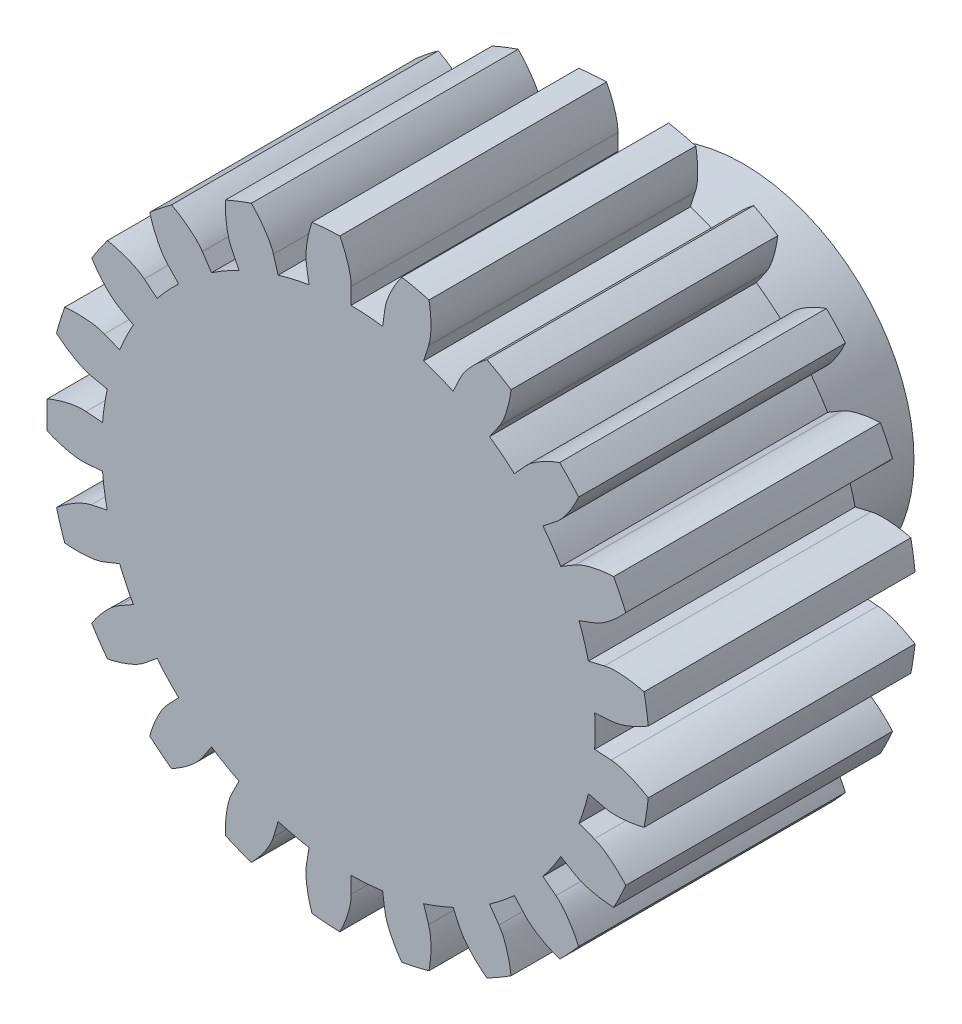
from build123d import *

# Parameters (mm, degrees)
SKETCH_1_R               = 5.75
SKETCH_1_R_2             = 1.475
EXTRUDE_1_DEPTH          = 5
CUT_EXTRUDE_1_DEPTH      = 10.545941546
PATTERN_CIRCULAR_1_DEPTH = 5
SKETCH_2_R               = 1.475
EXTRUDE_2_DEPTH          = 5
SKETCH_3_R               = 3.2
SKETCH_3_R_2             = 2.2
EXTRUDE_3_DEPTH          = 2.4
SKETCH_5_R               = 1.2
CUT_EXTRUDE_2_DEPTH      = 1
SKETCH_6_OUTSIDE_W       = 17.032
SKETCH_6_OUTSIDE_H       = 17.06
SKETCH_6_OUTSIDE_R       = 5.65
CUT_EXTRUDE_3_DEPTH      = 11.992693278


# Read off the part's stored shape, not the designer's step: 阵列(圆周)1
with BuildPart() as part:
    # 草图1 → 凸台-拉伸1 (new body)
    with BuildSketch(Plane.XY):
        Circle(SKETCH_1_R)
        Circle(SKETCH_1_R_2, mode=Mode.SUBTRACT)
    extrude(amount=EXTRUDE_1_DEPTH)

    # 草图1<3> → 切除-拉伸1 (cut, through all)
    with BuildSketch(Plane.XY):
        with BuildLine():
            Line((4.923195788, 0.316927775), (4.615446536, 0.297116602))
            ThreePointArc((4.615446536, 0.297116602), (4.622611017, 0.148635076), (4.625, 0))
            ThreePointArc((4.625, 0), (4.622611017, -0.148635076), (4.615446536, -0.297116602))
            Line((4.615446536, -0.297116602), (4.923195788, -0.316927775))
            add(Edge.make_bspline(
                [(4.923195788, -0.316927775), (4.960723978, -0.31934363), (5.064950694, -0.333885203), (5.258056408, -0.392528318), (5.454545861, -0.4832362), (5.608701438, -0.573335861), (5.701232058, -0.634072387), (5.713983029, -0.642571358)],
                knots=[0, 0, 0, 0, 0, 0.005604068, 0.015718248, 0.029959916, 0.032248441, 0.032248441, 0.032248441, 0.032248441, 0.032248441], degree=4))
            ThreePointArc((5.713983029, -0.642571358), (5.740988696, -0.321789983), (5.75, 0))
            ThreePointArc((5.75, 0), (5.740988696, 0.321789983), (5.713983029, 0.642571358))
            add(Edge.make_bspline(
                [(4.923195788, 0.316927775), (4.960723978, 0.31934363), (5.064950694, 0.333885203), (5.258056408, 0.392528318), (5.454545861, 0.4832362), (5.608701438, 0.573335861), (5.701232058, 0.634072387), (5.713983029, 0.642571358)],
                knots=[0, 0, 0, 0, 0, 0.005604068, 0.015718248, 0.029959916, 0.032248441, 0.032248441, 0.032248441, 0.032248441, 0.032248441], degree=4))
        make_face()
    extrude(amount=CUT_EXTRUDE_1_DEPTH, mode=Mode.SUBTRACT)

    # 阵列(圆周)1 outline → 阵列(圆周)1 (cut)
    with BuildSketch(Plane.XY):
        with BuildLine():
            Line((4.497971852, 1.076510204), (4.797888114, 1.14828987))
            add(Edge.make_bspline(
                [(4.797888114, 1.14828987), (4.834461118, 1.157042973), (4.938343537, 1.173868805), (5.140155468, 1.174749947), (5.354652063, 1.145988245), (5.528516281, 1.105329614), (5.634838431, 1.07456532), (5.649528027, 1.070202349)],
                knots=[0, 0, 0, 0, 0, 0.005604068, 0.015718248, 0.029959916, 0.032248441, 0.032248441, 0.032248441, 0.032248441, 0.032248441], degree=4))
            ThreePointArc((5.649528027, 1.070202349), (5.494543634, 1.694842253), (5.270725563, 2.298249779))
            add(Edge.make_bspline(
                [(4.611055911, 1.753984996), (4.646204743, 1.76735515), (4.741514754, 1.811972045), (4.908755962, 1.92492872), (5.069779322, 2.069522988), (5.190528858, 2.201057927), (5.261046198, 2.286369979), (5.270725563, 2.298249779)],
                knots=[0, 0, 0, 0, 0, 0.005604068, 0.015718248, 0.029959916, 0.032248441, 0.032248441, 0.032248441, 0.032248441, 0.032248441], degree=4))
            Line((4.611055911, 1.753984996), (4.32281854, 1.644343293))
            ThreePointArc((4.32281854, 1.644343293), (4.419524227, 1.363242682), (4.497971852, 1.076510204))
        make_face()
        with BuildLine():
            add(Edge.make_bspline(
                [(4.611055911, -1.753984996), (4.646204743, -1.76735515), (4.741514754, -1.811972045), (4.908755962, -1.92492872), (5.069779322, -2.069522988), (5.190528858, -2.201057927), (5.261046198, -2.286369979), (5.270725562, -2.298249779)],
                knots=[0, 0, 0, 0, 0, 0.005604068, 0.015718248, 0.029959916, 0.032248441, 0.032248441, 0.032248441, 0.032248441, 0.032248441], degree=4))
            ThreePointArc((5.270725562, -2.298249779), (5.494543634, -1.694842253), (5.649528028, -1.070202349))
            add(Edge.make_bspline(
                [(4.797888114, -1.14828987), (4.834461118, -1.157042973), (4.938343537, -1.173868805), (5.140155468, -1.174749947), (5.354652063, -1.145988245), (5.528516281, -1.105329614), (5.634838431, -1.07456532), (5.649528028, -1.070202349)],
                knots=[0, 0, 0, 0, 0, 0.005604068, 0.015718248, 0.029959916, 0.032248441, 0.032248441, 0.032248441, 0.032248441, 0.032248441], degree=4))
            Line((4.797888114, -1.14828987), (4.497971852, -1.076510204))
            ThreePointArc((4.497971852, -1.076510204), (4.419524227, -1.363242682), (4.32281854, -1.644343293))
            Line((4.32281854, -1.644343293), (4.611055911, -1.753984996))
        make_face()
        with BuildLine():
            add(Edge.make_bspline(
                [(3.889203481, -3.035192954), (3.918849827, -3.058329409), (3.996774421, -3.12905722), (4.123291007, -3.286290758), (4.234540642, -3.471923576), (4.311155011, -3.633206338), (4.353393294, -3.735513566), (4.359141, -3.749718622)],
                knots=[0, 0, 0, 0, 0, 0.005604068, 0.015718248, 0.029959916, 0.032248441, 0.032248441, 0.032248441, 0.032248441, 0.032248441], degree=4))
            ThreePointArc((4.359141, -3.749718622), (4.750872953, -3.239090334), (5.083087669, -2.687883881))
            add(Edge.make_bspline(
                [(4.246267026, -2.511476921), (4.278635171, -2.53062123), (4.372942885, -2.577319418), (4.565529157, -2.637646525), (4.77897393, -2.673386606), (4.957098192, -2.685781701), (5.067764682, -2.687723183), (5.083087669, -2.687883881)],
                knots=[0, 0, 0, 0, 0, 0.005604068, 0.015718248, 0.029959916, 0.032248441, 0.032248441, 0.032248441, 0.032248441, 0.032248441], degree=4))
            Line((4.246267026, -2.511476921), (3.98083263, -2.354484354))
            ThreePointArc((3.98083263, -2.354484354), (3.821354331, -2.605355269), (3.646089147, -2.845462867))
            Line((3.646089147, -2.845462867), (3.889203481, -3.035192954))
        make_face()
        with BuildLine():
            add(Edge.make_bspline(
                [(2.821778254, -4.046710697), (2.843287907, -4.077557678), (2.896903141, -4.168111928), (2.971453551, -4.35565144), (3.023044444, -4.565828519), (3.048716122, -4.742528422), (3.058922292, -4.852740379), (3.060227629, -4.86800851)],
                knots=[0, 0, 0, 0, 0, 0.005604068, 0.015718248, 0.029959916, 0.032248441, 0.032248441, 0.032248441, 0.032248441, 0.032248441], degree=4))
            ThreePointArc((3.060227629, -4.86800851), (3.585066361, -4.495531025), (4.064992664, -4.066735134))
            add(Edge.make_bspline(
                [(3.317346479, -3.651508226), (3.342633714, -3.679342685), (3.418987068, -3.75176389), (3.585235545, -3.866176633), (3.778662992, -3.963242834), (3.945220174, -4.027590298), (4.050397801, -4.062065045), (4.064992664, -4.066735134)],
                knots=[0, 0, 0, 0, 0, 0.005604068, 0.015718248, 0.029959916, 0.032248441, 0.032248441, 0.032248441, 0.032248441, 0.032248441], degree=4))
            Line((3.317346479, -3.651508226), (3.109978959, -3.423252236))
            ThreePointArc((3.109978959, -3.423252236), (2.883640334, -3.615970606), (2.645388733, -3.793750578))
            Line((2.645388733, -3.793750578), (2.821778254, -4.046710697))
        make_face()
        with BuildLine():
            add(Edge.make_bspline(
                [(1.503625646, -4.698660436), (1.515087378, -4.734477054), (1.539629304, -4.836811601), (1.555589407, -5.037993377), (1.54293748, -5.254039561), (1.515385427, -5.430456043), (1.492652621, -5.538779913), (1.489399604, -5.553754479)],
                knots=[0, 0, 0, 0, 0, 0.005604068, 0.015718248, 0.029959916, 0.032248441, 0.032248441, 0.032248441, 0.032248441, 0.032248441], degree=4))
            ThreePointArc((1.489399604, -5.553754479), (2.10071089, -5.352524055), (2.685705221, -5.084239124))
            add(Edge.make_bspline(
                [(2.093665138, -4.467087001), (2.109624581, -4.501138397), (2.161239245, -4.592847677), (2.286378021, -4.751179981), (2.442601265, -4.900947544), (2.58279203, -5.011529822), (2.6731353, -5.075474603), (2.685705221, -5.084239124)],
                knots=[0, 0, 0, 0, 0, 0.005604068, 0.015718248, 0.029959916, 0.032248441, 0.032248441, 0.032248441, 0.032248441, 0.032248441], degree=4))
            Line((2.093665138, -4.467087001), (1.96279001, -4.187849135))
            ThreePointArc((1.96279001, -4.187849135), (1.689702238, -4.305291087), (1.409633921, -4.404946902))
            Line((1.409633921, -4.404946902), (1.503625646, -4.698660436))
        make_face()
        with BuildLine():
            add(Edge.make_bspline(
                [(0.051869301, -4.933113576), (0.052264687, -4.970717367), (0.045552647, -5.075739337), (0.001504318, -5.272687494), (-0.074266251, -5.475406131), (-0.152593914, -5.635863813), (-0.206245786, -5.732674546), (-0.213768111, -5.746024991)],
                knots=[0, 0, 0, 0, 0, 0.005604068, 0.015718248, 0.029959916, 0.032248441, 0.032248441, 0.032248441, 0.032248441, 0.032248441], degree=4))
            ThreePointArc((-0.213768111, -5.746024991), (0.429698038, -5.733921834), (1.067781084, -5.649986156))
            add(Edge.make_bspline(
                [(0.683952463, -4.885745492), (0.689166047, -4.922988208), (0.711455832, -5.025836792), (0.784365777, -5.214020138), (0.889503696, -5.403181558), (0.990871481, -5.550172928), (1.058352997, -5.637905968), (1.067781084, -5.649986156)],
                knots=[0, 0, 0, 0, 0, 0.005604068, 0.015718248, 0.029959916, 0.032248441, 0.032248441, 0.032248441, 0.032248441, 0.032248441], degree=4))
            Line((0.683952463, -4.885745492), (0.641198555, -4.58033726))
            ThreePointArc((0.641198555, -4.58033726), (0.345626683, -4.612067562), (0.048626948, -4.624744363))
            Line((0.048626948, -4.624744363), (0.051869301, -4.933113576))
        make_face()
        with BuildLine():
            add(Edge.make_bspline(
                [(-1.404495859, -4.729237926), (-1.415201951, -4.765287628), (-1.452571563, -4.863665358), (-1.552714436, -5.038880188), (-1.684871098, -5.210258837), (-1.807014616, -5.340500352), (-1.886818351, -5.417195888), (-1.897941592, -5.427735966)],
                knots=[0, 0, 0, 0, 0, 0.005604068, 0.015718248, 0.029959916, 0.032248441, 0.032248441, 0.032248441, 0.032248441, 0.032248441], degree=4))
            ThreePointArc((-1.897941592, -5.427735966), (-1.27949537, -5.605835495), (-0.645020088, -5.713707123))
            add(Edge.make_bspline(
                [(-0.786532391, -4.870284055), (-0.792527914, -4.907408914), (-0.801543555, -5.012258252), (-0.787340809, -5.213571724), (-0.74263018, -5.425319178), (-0.689092349, -5.595658814), (-0.650468614, -5.699384647), (-0.645020088, -5.713707123)],
                knots=[0, 0, 0, 0, 0, 0.005604068, 0.015718248, 0.029959916, 0.032248441, 0.032248441, 0.032248441, 0.032248441, 0.032248441], degree=4))
            Line((-0.786532391, -4.870284055), (-0.737366206, -4.565842319))
            ThreePointArc((-0.737366206, -4.565842319), (-1.02915932, -4.509041594), (-1.316700742, -4.433612991))
            Line((-1.316700742, -4.433612991), (-1.404495859, -4.729237926))
        make_face()
        with BuildLine():
            add(Edge.make_bspline(
                [(-2.736065398, -4.105148733), (-2.756921685, -4.136441171), (-2.821628415, -4.219433368), (-2.968967699, -4.357346265), (-3.145767755, -4.482157182), (-3.300874139, -4.570609997), (-3.399738824, -4.620375602), (-3.413474634, -4.627168781)],
                knots=[0, 0, 0, 0, 0, 0.005604068, 0.015718248, 0.029959916, 0.032248441, 0.032248441, 0.032248441, 0.032248441, 0.032248441], degree=4))
            ThreePointArc((-3.413474634, -4.627168781), (-2.875, -4.979646072), (-2.300508395, -5.269740138))
            add(Edge.make_bspline(
                [(-2.18713039, -4.422076508), (-2.203802293, -4.455784801), (-2.243322279, -4.553318571), (-2.289088709, -4.749874583), (-2.308778105, -4.965393381), (-2.307827299, -5.143945858), (-2.301493234, -5.254447989), (-2.300508395, -5.269740138)],
                knots=[0, 0, 0, 0, 0, 0.005604068, 0.015718248, 0.029959916, 0.032248441, 0.032248441, 0.032248441, 0.032248441, 0.032248441], degree=4))
            Line((-2.18713039, -4.422076508), (-2.050412743, -4.145652251))
            ThreePointArc((-2.050412743, -4.145652251), (-2.3125, -4.005367493), (-2.565033793, -3.848535649))
            Line((-2.565033793, -3.848535649), (-2.736065398, -4.105148733))
        make_face()
        with BuildLine():
            add(Edge.make_bspline(
                [(-3.82452352, -3.116299059), (-3.853676829, -3.140053764), (-3.939971199, -3.200286207), (-4.121415153, -3.288643004), (-4.327149142, -3.355796191), (-4.501436509, -3.394600886), (-4.610577583, -3.413014668), (-4.625705474, -3.415457344)],
                knots=[0, 0, 0, 0, 0, 0.005604068, 0.015718248, 0.029959916, 0.032248441, 0.032248441, 0.032248441, 0.032248441, 0.032248441], degree=4))
            ThreePointArc((-4.625705474, -3.415457344), (-4.215048263, -3.910993242), (-3.751586435, -4.357533617))
            add(Edge.make_bspline(
                [(-3.393392255, -3.580948056), (-3.419259167, -3.608244655), (-3.485771974, -3.689796553), (-3.587441031, -3.864130241), (-3.669780964, -4.064270592), (-3.721501666, -4.235170738), (-3.748020081, -4.342630568), (-3.751586435, -4.357533617)],
                knots=[0, 0, 0, 0, 0, 0.005604068, 0.015718248, 0.029959916, 0.032248441, 0.032248441, 0.032248441, 0.032248441, 0.032248441], degree=4))
            Line((-3.393392255, -3.580948056), (-3.18127111, -3.357102787))
            ThreePointArc((-3.18127111, -3.357102787), (-3.390364907, -3.145798912), (-3.585452335, -2.921499025))
            Line((-3.585452335, -2.921499025), (-3.82452352, -3.116299059))
        make_face()
        with BuildLine():
            add(Edge.make_bspline(
                [(-4.573155944, -1.850552538), (-4.608015875, -1.8646588), (-4.708230253, -1.896779572), (-4.907656784, -1.92772938), (-5.124044338, -1.931257982), (-5.302026492, -1.91696659), (-5.411746291, -1.902392403), (-5.426922084, -1.900267533)],
                knots=[0, 0, 0, 0, 0, 0.005604068, 0.015718248, 0.029959916, 0.032248441, 0.032248441, 0.032248441, 0.032248441, 0.032248441], degree=4))
            ThreePointArc((-5.426922084, -1.900267533), (-5.18057099, -2.4948315), (-4.869319557, -3.05814111))
            add(Edge.make_bspline(
                [(-4.298136328, -2.421636656), (-4.330899858, -2.440096137), (-4.418495532, -2.498419919), (-4.567033475, -2.635040969), (-4.70470768, -2.802019525), (-4.804504278, -2.950082113), (-4.861518895, -3.044951364), (-4.869319557, -3.05814111)],
                knots=[0, 0, 0, 0, 0, 0.005604068, 0.015718248, 0.029959916, 0.032248441, 0.032248441, 0.032248441, 0.032248441, 0.032248441], degree=4))
            Line((-4.298136328, -2.421636656), (-4.029459578, -2.270260009))
            ThreePointArc((-4.029459578, -2.270260009), (-4.166981014, -2.006712294), (-4.287287702, -1.734874393))
            Line((-4.287287702, -1.734874393), (-4.573155944, -1.850552538))
        make_face()
        with BuildLine():
            add(Edge.make_bspline(
                [(-4.915443393, -0.420376303), (-4.952912488, -0.423580718), (-5.058142386, -0.424735748), (-5.257831572, -0.395528542), (-5.465645708, -0.335119025), (-5.631508153, -0.2690014), (-5.732057592, -0.222734224), (-5.74593285, -0.216230613)],
                knots=[0, 0, 0, 0, 0, 0.005604068, 0.015718248, 0.029959916, 0.032248441, 0.032248441, 0.032248441, 0.032248441, 0.032248441], degree=4))
            ThreePointArc((-5.74593285, -0.216230613), (-5.685777251, -0.856993031), (-5.554392268, -1.487019346))
            add(Edge.make_bspline(
                [(-4.820972125, -1.047152211), (-4.857721092, -1.055134369), (-4.958616372, -1.085047711), (-5.140824952, -1.171816744), (-5.321600472, -1.290796727), (-5.460605601, -1.402865745), (-5.543050421, -1.476714868), (-5.554392268, -1.487019346)],
                knots=[0, 0, 0, 0, 0, 0.005604068, 0.015718248, 0.029959916, 0.032248441, 0.032248441, 0.032248441, 0.032248441, 0.032248441], degree=4))
            Line((-4.820972125, -1.047152211), (-4.51961288, -0.981694666))
            ThreePointArc((-4.51961288, -0.981694666), (-4.573342571, -0.689320481), (-4.608178743, -0.394098556))
            Line((-4.608178743, -0.394098556), (-4.915443393, -0.420376303))
        make_face()
        with BuildLine():
            add(Edge.make_bspline(
                [(-4.820972125, 1.047152211), (-4.857721092, 1.055134369), (-4.958616372, 1.085047711), (-5.140824952, 1.171816744), (-5.321600472, 1.290796727), (-5.460605601, 1.402865745), (-5.543050421, 1.476714868), (-5.554392268, 1.487019346)],
                knots=[0, 0, 0, 0, 0, 0.005604068, 0.015718248, 0.029959916, 0.032248441, 0.032248441, 0.032248441, 0.032248441, 0.032248441], degree=4))
            ThreePointArc((-5.554392268, 1.487019346), (-5.685777251, 0.856993031), (-5.74593285, 0.216230613))
            add(Edge.make_bspline(
                [(-4.915443393, 0.420376303), (-4.952912488, 0.423580718), (-5.058142386, 0.424735748), (-5.257831572, 0.395528542), (-5.465645708, 0.335119025), (-5.631508153, 0.2690014), (-5.732057592, 0.222734224), (-5.74593285, 0.216230613)],
                knots=[0, 0, 0, 0, 0, 0.005604068, 0.015718248, 0.029959916, 0.032248441, 0.032248441, 0.032248441, 0.032248441, 0.032248441], degree=4))
            Line((-4.915443393, 0.420376303), (-4.608178743, 0.394098556))
            ThreePointArc((-4.608178743, 0.394098556), (-4.573342571, 0.689320481), (-4.51961288, 0.981694666))
            Line((-4.51961288, 0.981694666), (-4.820972125, 1.047152211))
        make_face()
        with BuildLine():
            add(Edge.make_bspline(
                [(-4.298136328, 2.421636656), (-4.330899858, 2.440096137), (-4.418495532, 2.498419919), (-4.567033475, 2.635040969), (-4.70470768, 2.802019525), (-4.804504278, 2.950082113), (-4.861518895, 3.044951364), (-4.869319557, 3.05814111)],
                knots=[0, 0, 0, 0, 0, 0.005604068, 0.015718248, 0.029959916, 0.032248441, 0.032248441, 0.032248441, 0.032248441, 0.032248441], degree=4))
            ThreePointArc((-4.869319557, 3.05814111), (-5.18057099, 2.4948315), (-5.426922084, 1.900267533))
            add(Edge.make_bspline(
                [(-4.573155944, 1.850552538), (-4.608015875, 1.8646588), (-4.708230253, 1.896779572), (-4.907656784, 1.92772938), (-5.124044338, 1.931257982), (-5.302026492, 1.91696659), (-5.411746291, 1.902392403), (-5.426922084, 1.900267533)],
                knots=[0, 0, 0, 0, 0, 0.005604068, 0.015718248, 0.029959916, 0.032248441, 0.032248441, 0.032248441, 0.032248441, 0.032248441], degree=4))
            Line((-4.573155944, 1.850552538), (-4.287287702, 1.734874393))
            ThreePointArc((-4.287287702, 1.734874393), (-4.166981014, 2.006712294), (-4.029459578, 2.270260009))
            Line((-4.029459578, 2.270260009), (-4.298136328, 2.421636656))
        make_face()
        with BuildLine():
            add(Edge.make_bspline(
                [(-3.393392255, 3.580948056), (-3.419259167, 3.608244655), (-3.485771974, 3.689796553), (-3.587441031, 3.864130241), (-3.669780964, 4.064270592), (-3.721501666, 4.235170738), (-3.748020081, 4.342630568), (-3.751586435, 4.357533617)],
                knots=[0, 0, 0, 0, 0, 0.005604068, 0.015718248, 0.029959916, 0.032248441, 0.032248441, 0.032248441, 0.032248441, 0.032248441], degree=4))
            ThreePointArc((-3.751586435, 4.357533617), (-4.215048263, 3.910993242), (-4.625705474, 3.415457344))
            add(Edge.make_bspline(
                [(-3.82452352, 3.116299059), (-3.853676829, 3.140053764), (-3.939971199, 3.200286207), (-4.121415153, 3.288643004), (-4.327149142, 3.355796191), (-4.501436509, 3.394600886), (-4.610577583, 3.413014668), (-4.625705474, 3.415457344)],
                knots=[0, 0, 0, 0, 0, 0.005604068, 0.015718248, 0.029959916, 0.032248441, 0.032248441, 0.032248441, 0.032248441, 0.032248441], degree=4))
            Line((-3.82452352, 3.116299059), (-3.585452335, 2.921499025))
            ThreePointArc((-3.585452335, 2.921499025), (-3.390364907, 3.145798912), (-3.18127111, 3.357102787))
            Line((-3.18127111, 3.357102787), (-3.393392255, 3.580948056))
        make_face()
        with BuildLine():
            add(Edge.make_bspline(
                [(-2.18713039, 4.422076508), (-2.203802293, 4.455784801), (-2.243322279, 4.553318571), (-2.289088709, 4.749874583), (-2.308778105, 4.965393381), (-2.307827299, 5.143945858), (-2.301493234, 5.254447989), (-2.300508395, 5.269740138)],
                knots=[0, 0, 0, 0, 0, 0.005604068, 0.015718248, 0.029959916, 0.032248441, 0.032248441, 0.032248441, 0.032248441, 0.032248441], degree=4))
            ThreePointArc((-2.300508395, 5.269740138), (-2.875, 4.979646072), (-3.413474634, 4.627168781))
            add(Edge.make_bspline(
                [(-2.736065398, 4.105148733), (-2.756921685, 4.136441171), (-2.821628415, 4.219433368), (-2.968967699, 4.357346265), (-3.145767755, 4.482157182), (-3.300874139, 4.570609997), (-3.399738824, 4.620375602), (-3.413474634, 4.627168781)],
                knots=[0, 0, 0, 0, 0, 0.005604068, 0.015718248, 0.029959916, 0.032248441, 0.032248441, 0.032248441, 0.032248441, 0.032248441], degree=4))
            Line((-2.736065398, 4.105148733), (-2.565033793, 3.848535649))
            ThreePointArc((-2.565033793, 3.848535649), (-2.3125, 4.005367493), (-2.050412743, 4.145652251))
            Line((-2.050412743, 4.145652251), (-2.18713039, 4.422076508))
        make_face()
        with BuildLine():
            add(Edge.make_bspline(
                [(-0.786532391, 4.870284055), (-0.792527914, 4.907408914), (-0.801543555, 5.012258252), (-0.787340809, 5.213571724), (-0.74263018, 5.425319178), (-0.689092349, 5.595658814), (-0.650468614, 5.699384647), (-0.645020088, 5.713707123)],
                knots=[0, 0, 0, 0, 0, 0.005604068, 0.015718248, 0.029959916, 0.032248441, 0.032248441, 0.032248441, 0.032248441, 0.032248441], degree=4))
            ThreePointArc((-0.645020088, 5.713707123), (-1.27949537, 5.605835495), (-1.897941592, 5.427735966))
            add(Edge.make_bspline(
                [(-1.404495859, 4.729237926), (-1.415201951, 4.765287628), (-1.452571563, 4.863665358), (-1.552714436, 5.038880188), (-1.684871098, 5.210258837), (-1.807014616, 5.340500352), (-1.886818351, 5.417195888), (-1.897941592, 5.427735966)],
                knots=[0, 0, 0, 0, 0, 0.005604068, 0.015718248, 0.029959916, 0.032248441, 0.032248441, 0.032248441, 0.032248441, 0.032248441], degree=4))
            Line((-1.404495859, 4.729237926), (-1.316700742, 4.433612991))
            ThreePointArc((-1.316700742, 4.433612991), (-1.02915932, 4.509041594), (-0.737366206, 4.565842319))
            Line((-0.737366206, 4.565842319), (-0.786532391, 4.870284055))
        make_face()
        with BuildLine():
            add(Edge.make_bspline(
                [(0.683952463, 4.885745492), (0.689166047, 4.922988208), (0.711455832, 5.025836792), (0.784365777, 5.214020138), (0.889503696, 5.403181558), (0.990871481, 5.550172928), (1.058352997, 5.637905968), (1.067781084, 5.649986155)],
                knots=[0, 0, 0, 0, 0, 0.005604068, 0.015718248, 0.029959916, 0.032248441, 0.032248441, 0.032248441, 0.032248441, 0.032248441], degree=4))
            ThreePointArc((1.067781084, 5.649986155), (0.429698038, 5.733921834), (-0.213768111, 5.746024991))
            add(Edge.make_bspline(
                [(0.051869301, 4.933113576), (0.052264687, 4.970717367), (0.045552647, 5.075739337), (0.001504318, 5.272687494), (-0.074266251, 5.475406131), (-0.152593914, 5.635863813), (-0.206245786, 5.732674546), (-0.213768111, 5.746024991)],
                knots=[0, 0, 0, 0, 0, 0.005604068, 0.015718248, 0.029959916, 0.032248441, 0.032248441, 0.032248441, 0.032248441, 0.032248441], degree=4))
            Line((0.051869301, 4.933113576), (0.048626948, 4.624744363))
            ThreePointArc((0.048626948, 4.624744363), (0.345626683, 4.612067562), (0.641198555, 4.58033726))
            Line((0.641198555, 4.58033726), (0.683952463, 4.885745492))
        make_face()
        with BuildLine():
            add(Edge.make_bspline(
                [(2.093665138, 4.467087001), (2.109624581, 4.501138397), (2.161239245, 4.592847677), (2.286378021, 4.751179981), (2.442601265, 4.900947544), (2.58279203, 5.011529822), (2.6731353, 5.075474603), (2.685705221, 5.084239123)],
                knots=[0, 0, 0, 0, 0, 0.005604068, 0.015718248, 0.029959916, 0.032248441, 0.032248441, 0.032248441, 0.032248441, 0.032248441], degree=4))
            ThreePointArc((2.685705221, 5.084239123), (2.10071089, 5.352524055), (1.489399605, 5.55375448))
            add(Edge.make_bspline(
                [(1.503625646, 4.698660436), (1.515087378, 4.734477054), (1.539629304, 4.836811601), (1.555589407, 5.037993377), (1.54293748, 5.254039561), (1.515385427, 5.430456043), (1.492652621, 5.538779913), (1.489399605, 5.55375448)],
                knots=[0, 0, 0, 0, 0, 0.005604068, 0.015718248, 0.029959916, 0.032248441, 0.032248441, 0.032248441, 0.032248441, 0.032248441], degree=4))
            Line((1.503625646, 4.698660436), (1.409633921, 4.404946902))
            ThreePointArc((1.409633921, 4.404946902), (1.689702238, 4.305291087), (1.96279001, 4.187849135))
            Line((1.96279001, 4.187849135), (2.093665138, 4.467087001))
        make_face()
        with BuildLine():
            add(Edge.make_bspline(
                [(3.317346479, 3.651508226), (3.342633714, 3.679342685), (3.418987068, 3.75176389), (3.585235545, 3.866176633), (3.778662992, 3.963242834), (3.945220174, 4.027590298), (4.050397801, 4.062065045), (4.064992663, 4.066735134)],
                knots=[0, 0, 0, 0, 0, 0.005604068, 0.015718248, 0.029959916, 0.032248441, 0.032248441, 0.032248441, 0.032248441, 0.032248441], degree=4))
            ThreePointArc((4.064992663, 4.066735134), (3.585066361, 4.495531025), (3.060227629, 4.868008511))
            add(Edge.make_bspline(
                [(2.821778254, 4.046710697), (2.843287907, 4.077557678), (2.896903141, 4.168111928), (2.971453551, 4.35565144), (3.023044444, 4.565828519), (3.048716122, 4.742528422), (3.058922292, 4.852740379), (3.060227629, 4.868008511)],
                knots=[0, 0, 0, 0, 0, 0.005604068, 0.015718248, 0.029959916, 0.032248441, 0.032248441, 0.032248441, 0.032248441, 0.032248441], degree=4))
            Line((2.821778254, 4.046710697), (2.645388733, 3.793750578))
            ThreePointArc((2.645388733, 3.793750578), (2.883640334, 3.615970606), (3.109978959, 3.423252236))
            Line((3.109978959, 3.423252236), (3.317346479, 3.651508226))
        make_face()
        with BuildLine():
            add(Edge.make_bspline(
                [(4.246267026, 2.511476921), (4.278635171, 2.53062123), (4.372942885, 2.577319418), (4.565529157, 2.637646525), (4.77897393, 2.673386606), (4.957098192, 2.685781701), (5.067764682, 2.687723183), (5.083087668, 2.687883881)],
                knots=[0, 0, 0, 0, 0, 0.005604068, 0.015718248, 0.029959916, 0.032248441, 0.032248441, 0.032248441, 0.032248441, 0.032248441], degree=4))
            ThreePointArc((5.083087668, 2.687883881), (4.750872953, 3.239090334), (4.359141, 3.749718623))
            add(Edge.make_bspline(
                [(3.889203481, 3.035192954), (3.918849827, 3.058329409), (3.996774421, 3.12905722), (4.123291007, 3.286290758), (4.234540642, 3.471923576), (4.311155011, 3.633206338), (4.353393294, 3.735513566), (4.359141, 3.749718623)],
                knots=[0, 0, 0, 0, 0, 0.005604068, 0.015718248, 0.029959916, 0.032248441, 0.032248441, 0.032248441, 0.032248441, 0.032248441], degree=4))
            Line((3.889203481, 3.035192954), (3.646089147, 2.845462867))
            ThreePointArc((3.646089147, 2.845462867), (3.821354331, 2.605355269), (3.98083263, 2.354484354))
            Line((3.98083263, 2.354484354), (4.246267026, 2.511476921))
        make_face()
    extrude(amount=PATTERN_CIRCULAR_1_DEPTH, mode=Mode.SUBTRACT)

    # 草图2 → 凸台-拉伸2 (add, through all)
    with BuildSketch(Plane.XY.offset(5)):
        Circle(SKETCH_2_R)
    extrude(amount=-EXTRUDE_2_DEPTH)

    # 草图3 → 凸台-拉伸3 (add)
    # profile 1 of 2: a face of its own
    with BuildSketch(Plane(origin=(0, 0, 0), x_dir=(-1, 0, 0), z_dir=(0, 0, -1))):
        with Locations(Location((0, 0, 0), (0, 0, 180))):
            Circle(SKETCH_3_R)
        Circle(SKETCH_3_R_2, mode=Mode.SUBTRACT)
    # profile 2 of 2: a face of its own
    with BuildSketch(Plane(origin=(0, 0, 0), x_dir=(-1, 0, 0), z_dir=(0, 0, -1))):
        Polygon((0.6, -1.039230485), (1.2, 0), (0.6, 1.039230485), (-0.6, 1.039230485), (-1.2, 0), (-0.6, -1.039230485), align=None)
    extrude(amount=EXTRUDE_3_DEPTH)

    # 草图5 → 切除-拉伸2 (cut)
    with BuildSketch(Plane(origin=(0, 0, -2.4), x_dir=(-1, 0, 0), z_dir=(0, 0, -1))):
        Circle(SKETCH_5_R)
    extrude(amount=-CUT_EXTRUDE_2_DEPTH, mode=Mode.SUBTRACT)

    # 草图6 outside → 切除-拉伸3 (cut, through all)
    with BuildSketch(Plane.XY.offset(5)):
        with Locations((-0.018, 0)):
            Rectangle(SKETCH_6_OUTSIDE_W, SKETCH_6_OUTSIDE_H)
        Circle(SKETCH_6_OUTSIDE_R, mode=Mode.SUBTRACT)
    extrude(amount=-CUT_EXTRUDE_3_DEPTH, mode=Mode.SUBTRACT)


solid = part.part
